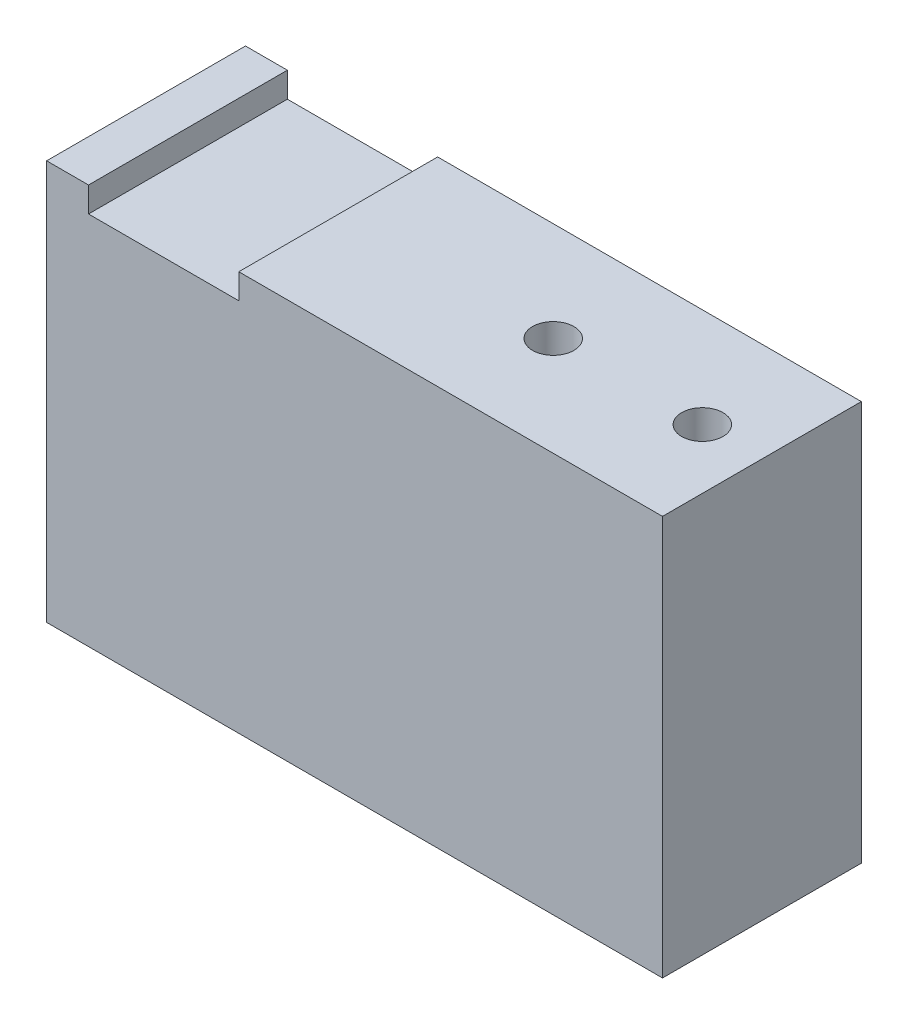
from build123d import *

# Parameters (mm, degrees)
SKETCH_216_W        = 62.5
SKETCH_216_H        = 20.18
EXTRUDE_1_DEPTH     = 40.57
SKETCH_6_W          = 15.25
SKETCH_6_H          = 20.18
CUT_EXTRUDE_1_DEPTH = 2.55
SKETCH_7_R          = 2.1
CUT_EXTRUDE_2_DEPTH = 15
SKETCH_8_R          = 2.5
CUT_EXTRUDE_4_DEPTH = 15


with BuildPart() as part:
    # Sketch 216 → Бобышка-Вытянуть1 (new body)
    with BuildSketch(Plane(origin=(0, 0, 0), x_dir=(1, 0, 0), z_dir=(0, 1, 0))):
        Rectangle(SKETCH_216_W, SKETCH_216_H)
    extrude(amount=EXTRUDE_1_DEPTH)

    # Эскиз6 → Вырез-Вытянуть1 (cut)
    with BuildSketch(Plane(origin=(0, 40.57, 0), x_dir=(1, 0, 0), z_dir=(0, 1, 0))):
        with Locations((-19.375, 0)):
            Rectangle(SKETCH_6_W, SKETCH_6_H)
    extrude(amount=-CUT_EXTRUDE_1_DEPTH, mode=Mode.SUBTRACT)

    # Эскиз7 → Вырез-Вытянуть2 (cut)
    with BuildSketch(Plane(origin=(0, 40.57, 0), x_dir=(1, 0, 0), z_dir=(0, 1, 0))):
        with Locations((10.07, 0)):
            Circle(SKETCH_7_R)
        with Locations((25.2, 0)):
            Circle(SKETCH_7_R)
    extrude(amount=-CUT_EXTRUDE_2_DEPTH, mode=Mode.SUBTRACT)

    # Эскиз8 → Вырез-Вытянуть4 (cut)
    with BuildSketch(Plane.XZ):
        with Locations((17, 0)):
            Circle(SKETCH_8_R)
        with Locations((-17, 0)):
            Circle(SKETCH_8_R)
    extrude(amount=-CUT_EXTRUDE_4_DEPTH, mode=Mode.SUBTRACT)


solid = part.part
